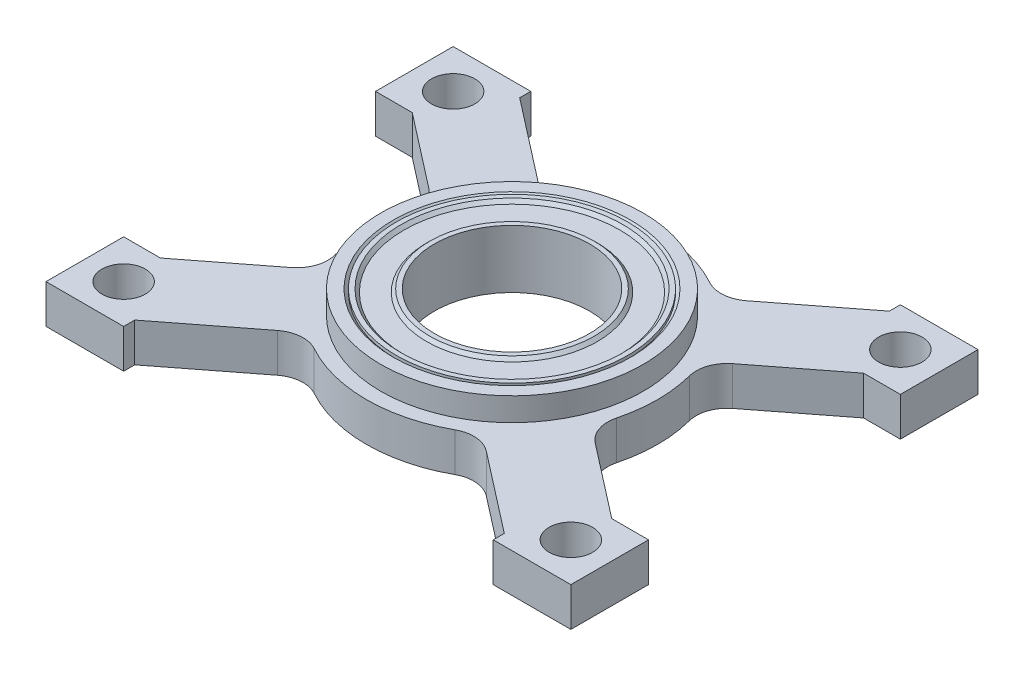
from build123d import *

# Parameters (mm, degrees)
SKETCH1_R           = 9.4615
SKETCH1_R_2         = 1.778
BOSS_EXTRUDE1_DEPTH = 3.175
SKETCH2_R           = 10.7315
SKETCH2_R_2         = 9.4615
BOSS_EXTRUDE2_DEPTH = 1.905
CHAMFER1_SIZE       = 0.254
SKETCH3_R           = 9.4615
SKETCH3_R_2         = 8.8265
BOSS_EXTRUDE3_DEPTH = 4.7625
CHAMFER2_SIZE       = 0.254
SKETCH4_R           = 8.8265
SKETCH4_R_2         = 6.985
BOSS_EXTRUDE4_DEPTH = 4.2545
SKETCH5_R           = 6.985
SKETCH5_R_2         = 6.35
BOSS_EXTRUDE5_DEPTH = 4.7625
CHAMFER3_SIZE       = 0.254


with BuildPart() as part:
    # Sketch1 → Boss-Extrude1 (new body)
    with BuildSketch(Plane(origin=(0, 0, 0), x_dir=(1, 0, 0), z_dir=(0, 1, 0))):
        with BuildLine():
            Line((-15.113, -16.6497), (-15.113, -15.742069175))
            Line((-15.113, -15.742069175), (-8.537191562, -10.640953872))
            ThreePointArc((-8.537191562, -10.640953872), (-7.177584853, -10.115559905), (-5.753021125, -10.424084468))
            ThreePointArc((-5.753021125, -10.424084468), (0, -11.90625), (5.753021125, -10.424084468))
            ThreePointArc((5.753021125, -10.424084468), (7.177584853, -10.115559905), (8.537191562, -10.640953872))
            Line((8.537191562, -10.640953872), (15.113, -15.742069175))
            Line((15.113, -15.742069175), (15.113, -16.6497))
            Line((15.113, -16.6497), (21.463, -16.6497))
            Line((21.463, -16.6497), (21.463, -10.2997))
            Line((21.463, -10.2997), (18.457244016, -10.2997))
            Line((18.457244016, -10.2997), (12.429339722, -5.623615663))
            ThreePointArc((12.429339722, -5.623615663), (11.582420607, -4.43732007), (11.527087077, -2.980780533))
            ThreePointArc((11.527087077, -2.980780533), (11.90625, 0), (11.527087077, 2.980780533))
            ThreePointArc((11.527087077, 2.980780533), (11.582420607, 4.43732007), (12.429339722, 5.623615663))
            Line((12.429339722, 5.623615663), (18.457244016, 10.2997))
            Line((18.457244016, 10.2997), (21.463, 10.2997))
            Line((21.463, 10.2997), (21.463, 16.6497))
            Line((21.463, 16.6497), (15.113, 16.6497))
            Line((15.113, 16.6497), (15.113, 15.742069175))
            Line((15.113, 15.742069175), (8.537191562, 10.640953872))
            ThreePointArc((8.537191562, 10.640953872), (7.177584853, 10.115559905), (5.753021125, 10.424084468))
            ThreePointArc((5.753021125, 10.424084468), (0, 11.90625), (-5.753021125, 10.424084468))
            ThreePointArc((-5.753021125, 10.424084468), (-7.177584853, 10.115559905), (-8.537191562, 10.640953872))
            Line((-8.537191562, 10.640953872), (-15.113, 15.742069175))
            Line((-15.113, 15.742069175), (-15.113, 16.6497))
            Line((-15.113, 16.6497), (-21.463, 16.6497))
            Line((-21.463, 16.6497), (-21.463, 10.2997))
            Line((-21.463, 10.2997), (-18.457244016, 10.2997))
            Line((-18.457244016, 10.2997), (-12.429339722, 5.623615663))
            ThreePointArc((-12.429339722, 5.623615663), (-11.582420607, 4.43732007), (-11.527087077, 2.980780533))
            ThreePointArc((-11.527087077, 2.980780533), (-11.90625, 0), (-11.527087077, -2.980780533))
            ThreePointArc((-11.527087077, -2.980780533), (-11.582420607, -4.43732007), (-12.429339722, -5.623615663))
            Line((-12.429339722, -5.623615663), (-18.457244016, -10.2997))
            Line((-18.457244016, -10.2997), (-21.463, -10.2997))
            Line((-21.463, -10.2997), (-21.463, -16.6497))
            Line((-21.463, -16.6497), (-15.113, -16.6497))
        make_face()
        with Locations(Location((0, 0, 0), (0, 0, 270))):
            Circle(SKETCH1_R, mode=Mode.SUBTRACT)
        with Locations(Location((-18.288, -13.4747, 0), (0, 0, 270))):
            Circle(SKETCH1_R_2, mode=Mode.SUBTRACT)
        with Locations(Location((-18.288, 13.4747, 0), (0, 0, 270))):
            Circle(SKETCH1_R_2, mode=Mode.SUBTRACT)
        with Locations(Location((18.288, -13.4747, 0), (0, 0, 270))):
            Circle(SKETCH1_R_2, mode=Mode.SUBTRACT)
        with Locations(Location((18.288, 13.4747, 0), (0, 0, 270))):
            Circle(SKETCH1_R_2, mode=Mode.SUBTRACT)
    extrude(amount=BOSS_EXTRUDE1_DEPTH)

    # Sketch2 → Boss-Extrude2 (add)
    with BuildSketch(Plane(origin=(0, 3.175, 0), x_dir=(1, 0, 0), z_dir=(0, 1, 0))):
        with Locations(Location((0, 0, 0), (0, 0, 90))):
            Circle(SKETCH2_R)
        with Locations(Location((0, 0, 0), (0, 0, 270))):
            Circle(SKETCH2_R_2, mode=Mode.SUBTRACT)
    extrude(amount=BOSS_EXTRUDE2_DEPTH)

    # Chamfer1
    chamfer1_edges = [part.edges().sort_by_distance(p)[0] for p in [
        (0, 5.08, -9.4615),
        (0, 0, -9.4615),
    ]]
    chamfer(chamfer1_edges, length=CHAMFER1_SIZE)



with BuildPart() as body_2:
    # Sketch3 → Boss-Extrude3 (new body)
    with BuildSketch(Plane(origin=(0, 5.08, 0), x_dir=(1, 0, 0), z_dir=(0, 1, 0))):
        with Locations(Location((0, 0, 0), (0, 0, 270))):
            Circle(SKETCH3_R)
        with Locations(Location((0, 0, 0), (0, 0, 270))):
            Circle(SKETCH3_R_2, mode=Mode.SUBTRACT)
    extrude(amount=-BOSS_EXTRUDE3_DEPTH)

    # Chamfer2
    chamfer2_edges = [body_2.edges().sort_by_distance(p)[0] for p in [
        (0, 0.3175, -8.8265),
        (0, 5.08, -8.8265),
    ]]
    chamfer(chamfer2_edges, length=CHAMFER2_SIZE)


with BuildPart() as part_1:
    add(part.part)

    add(body_2.part)  # Boss-Extrude4 merges body 2
    # Sketch4 → Boss-Extrude4 (add)
    with BuildSketch(Plane(origin=(0, 4.826, 0), x_dir=(-1, 0, 0), z_dir=(0, 1, 0))):
        Circle(SKETCH4_R)
        with Locations(Location((0, 0, 0), (0, 0, 90))):
            Circle(SKETCH4_R_2, mode=Mode.SUBTRACT)
    extrude(amount=-BOSS_EXTRUDE4_DEPTH)

    # Sketch5 → Boss-Extrude5 (add)
    with BuildSketch(Plane(origin=(0, 5.08, 0), x_dir=(1, 0, 0), z_dir=(0, 1, 0))):
        with Locations(Location((0, 0, 0), (0, 0, 270))):
            Circle(SKETCH5_R)
        with Locations(Location((0, 0, 0), (0, 0, 270))):
            Circle(SKETCH5_R_2, mode=Mode.SUBTRACT)
    extrude(amount=-BOSS_EXTRUDE5_DEPTH)

    # Chamfer3
    chamfer3_edges = [part_1.edges().sort_by_distance(p)[0] for p in [
        (0, 0.3175, -6.985),
        (0, 5.08, -6.985),
    ]]
    chamfer(chamfer3_edges, length=CHAMFER3_SIZE - 0.0001)  # a hair under: the kernel refuses the full size


solid = part_1.part
